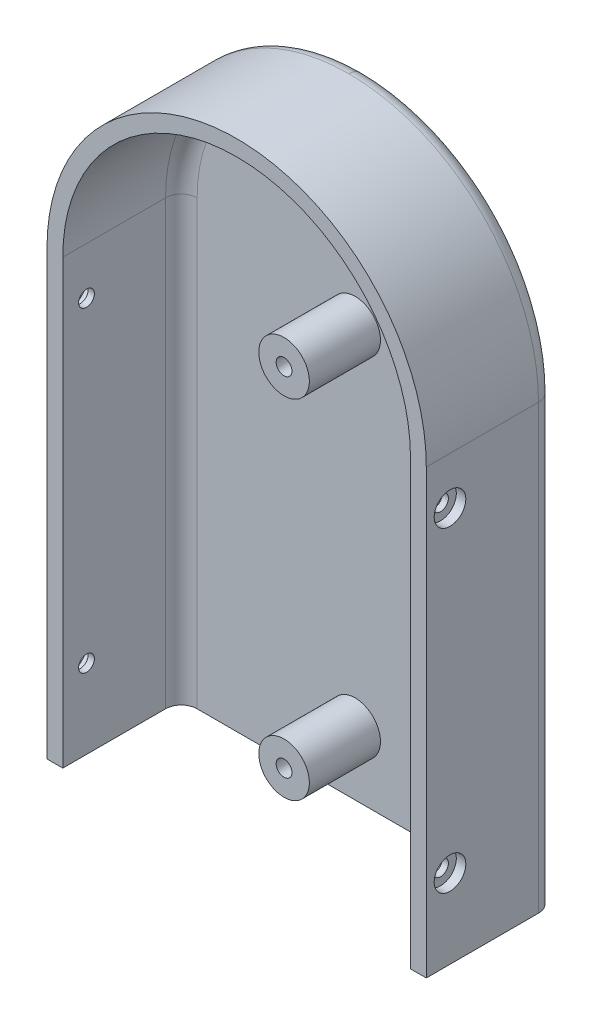
from build123d import *

# Parameters (mm, degrees)
SKETCH1_W           = 120
SKETCH1_H           = 200
BOSS_EXTRUDE1_DEPTH = 3
FILLET1_R           = 60
BOSS_EXTRUDE2_DEPTH = 37.5
FILLET2_R           = 5
SKETCH6_R           = 2.5
CUT_EXTRUDE1_DEPTH  = 37.5
SKETCH7_R           = 5
CUT_EXTRUDE2_DEPTH  = 3
SKETCH9_R           = 8
SKETCH9_R_2         = 2.5
BOSS_EXTRUDE3_DEPTH = 22.5
SKETCH10_R          = 6
CUT_EXTRUDE3_DEPTH  = 3
LPATTERN1_COUNT     = 2
LPATTERN1_PITCH     = 110


with BuildPart() as part:
    # Sketch1 → Boss-Extrude1 (new body)
    with BuildSketch(Plane.XY):
        Rectangle(SKETCH1_W, SKETCH1_H)
    extrude(amount=BOSS_EXTRUDE1_DEPTH)

    # Fillet1
    fillet1_edges = [part.edges().sort_by_distance(p)[0] for p in [
        (60, 100, 1.5),
        (-60, 100, 1.5),
    ]]
    fillet(fillet1_edges, radius=FILLET1_R - 0.0001)  # a hair under: the kernel refuses the full size

    # Sketch4 → Boss-Extrude2 (add)
    with BuildSketch(Plane.XY.offset(3)):
        with BuildLine():
            Line((55, -100), (55, 40))
            ThreePointArc((55, 40), (38.890872965, 78.890872965), (0, 95))
            ThreePointArc((0, 95), (-38.890872965, 78.890872965), (-55, 40))
            Line((-55, 40), (-55, -100))
            Line((-55, -100), (-60, -100))
            Line((-60, -100), (-60, 40))
            ThreePointArc((-60, 40), (-42.426406871, 82.426406871), (0, 100))
            ThreePointArc((0, 100), (42.426406871, 82.426406871), (60, 40))
            Line((60, 40), (60, -100))
            Line((60, -100), (55, -100))
        make_face()
    extrude(amount=BOSS_EXTRUDE2_DEPTH)

    # Fillet2
    fillet2_edges = [part.edges().sort_by_distance(p)[0] for p in [
        (-60, -29.99995, 0),
        (-42.426436161, 82.426436161, 0),
        (-55, -30, 3),
        (0, 95, 3),
        (55, -30, 3),
        (60, -29.99995, 0),
    ]]
    fillet(fillet2_edges, radius=FILLET2_R)

    # Sketch6 → Cut-Extrude1 (cut)
    with BuildSketch(Plane(origin=(60, 0, 0), x_dir=(0, 0, -1), z_dir=(1, 0, 0))):
        with Locations((-33, -75)):
            Circle(SKETCH6_R)
        with Locations((-33, 25)):
            Circle(SKETCH6_R)
    cut_extrude1 = extrude(amount=-CUT_EXTRUDE1_DEPTH, mode=Mode.SUBTRACT)

    # Sketch7 → Cut-Extrude2 (cut)
    with BuildSketch(Plane(origin=(60, 0, 0), x_dir=(0, 0, -1), z_dir=(1, 0, 0))):
        with Locations((-33, 25)):
            Circle(SKETCH7_R)
        with Locations((-33, -75)):
            Circle(SKETCH7_R)
    cut_extrude2 = extrude(amount=-CUT_EXTRUDE2_DEPTH, mode=Mode.SUBTRACT)

    # Mirror1: Cut-Extrude1, Cut-Extrude2 across plane
    add(cut_extrude1.mirror(Plane(origin=(0, 0, 0), x_dir=(0, 0, 1), z_dir=(1, 0, 0))), mode=Mode.SUBTRACT)
    add(cut_extrude2.mirror(Plane(origin=(0, 0, 0), x_dir=(0, 0, 1), z_dir=(1, 0, 0))), mode=Mode.SUBTRACT)

    # Sketch9 → Boss-Extrude3 (add)
    with BuildSketch(Plane.XY.offset(3)):
        with Locations(Location((0, 30, 0), (0, 0, 180))):
            Circle(SKETCH9_R)
        with Locations(Location((0, 30, 0), (0, 0, 180))):
            Circle(SKETCH9_R_2, mode=Mode.SUBTRACT)
    boss_extrude3 = extrude(amount=BOSS_EXTRUDE3_DEPTH)

    # Sketch10 → Cut-Extrude3 (cut)
    with BuildSketch(Plane.XY.offset(3)):
        with Locations((0, 30)):
            Circle(SKETCH10_R)
    cut_extrude3 = extrude(amount=-CUT_EXTRUDE3_DEPTH, mode=Mode.SUBTRACT)

    # LPattern1: Boss-Extrude3, Cut-Extrude3 ×2
    with Locations(*[(0, -i * LPATTERN1_PITCH, 0) for i in range(1, LPATTERN1_COUNT)]):
        add(boss_extrude3)
        add(cut_extrude3, mode=Mode.SUBTRACT)


solid = part.part
